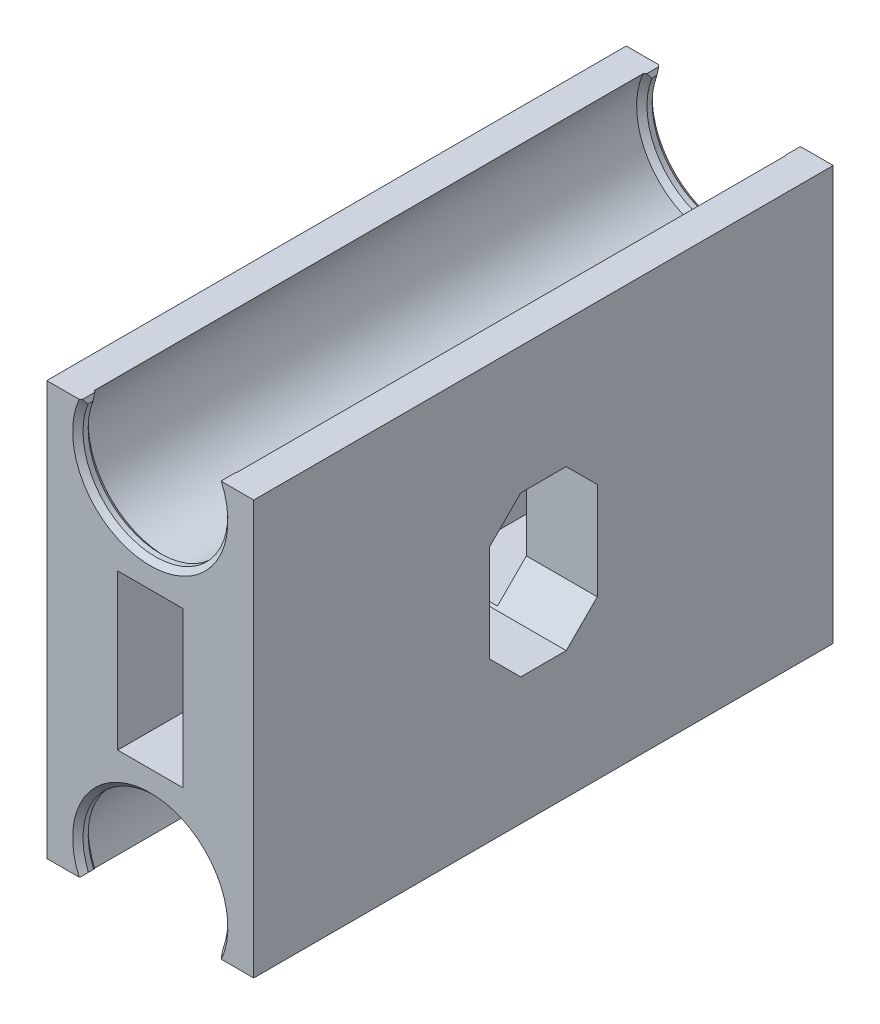
from build123d import *

# Parameters (mm, degrees)
SKETCH_1_W          = 6.3
SKETCH_1_H          = 15
EXTRUDE_1_DEPTH     = 56
CUT_EXTRUDE_START   = -1.5
SKETCH_2_R          = 7.5
CUT_EXTRUDE_1_DEPTH = 53
CHAMFER_1_SIZE      = 0.5
CHAMFER_1_SIZE_2    = 0.37535302
CUT_EXTRUDE_5_DEPTH = 57


with BuildPart() as part:
    # 草图1 → 凸台-拉伸1 (new body)
    with BuildSketch(Plane.XY):
        with BuildLine():
            Line((16.32455532, -40), (20, -40))
            Line((20, -40), (20, 0))
            Line((20, 0), (16.32455532, 0))
            ThreePointArc((16.32455532, 0), (10, -10), (3.67544468, 0))
            Line((3.67544468, 0), (0, 0))
            Line((0, 0), (0, -40))
            Line((0, -40), (3.67544468, -40))
            ThreePointArc((3.67544468, -40), (10, -30), (16.32455532, -40))
        make_face()
        with Locations((10, -20)):
            Rectangle(SKETCH_1_W, SKETCH_1_H, mode=Mode.SUBTRACT)
    extrude(amount=EXTRUDE_1_DEPTH)

    # 草图2 → 切除-拉伸1 (cut)
    with BuildSketch(Plane.XY.offset(56).offset(CUT_EXTRUDE_START)):
        with Locations((10, -3)):
            Circle(SKETCH_2_R)
        with Locations((10, -37)):
            Circle(SKETCH_2_R)
    extrude(amount=-CUT_EXTRUDE_1_DEPTH, mode=Mode.SUBTRACT)

    # 倒角1
    # the kernel refuses this chamfer: 0.5, 0.37535302 mm, written as the material it takes off along each edge
    with BuildSketch(Plane(origin=(10, -37, 56), x_dir=(-0.8097393602715859, -0.5867897139750857, 0), z_dir=(0.5867897139750857, -0.8097393602715859, 0))) as chamfer_1_piece_1:
        Polygon((7, CHAMFER_1_SIZE), (7 + CHAMFER_1_SIZE, 0), (7, 0), align=None)
    revolve(axis=Axis((10, -37, 56), (0, 0, -1)), revolution_arc=251.859051953, mode=Mode.SUBTRACT)
    with BuildSketch(Plane(origin=(10, -37, 54.5), x_dir=(-0.8097393602715859, -0.5867897139750857, 0), z_dir=(0.5867897139750857, -0.8097393602715859, 0))) as chamfer_1_piece_2:
        Polygon((7 + CHAMFER_1_SIZE, 0), (7, -CHAMFER_1_SIZE), (7, 0), align=None)
    revolve(axis=Axis((10, -37, 54.5), (0, 0, -1)), revolution_arc=251.859051953, mode=Mode.SUBTRACT)
    with BuildSketch(Plane(origin=(10, -37, 1.5), x_dir=(-0.8097393602715859, -0.5867897139750857, 0), z_dir=(0.5867897139750857, -0.8097393602715859, 0))) as chamfer_1_piece_3:
        Polygon((7, CHAMFER_1_SIZE), (7 + CHAMFER_1_SIZE, 0), (7, 0), align=None)
    revolve(axis=Axis((10, -37, 1.5), (0, 0, -1)), revolution_arc=251.859051953, mode=Mode.SUBTRACT)
    with BuildSketch(Plane(origin=(10, -37, 0), x_dir=(-0.8097393602715859, -0.5867897139750857, 0), z_dir=(0.5867897139750857, -0.8097393602715859, 0))) as chamfer_1_piece_4:
        Polygon((7, -CHAMFER_1_SIZE), (7 + CHAMFER_1_SIZE, 0), (7, 0), align=None)
    revolve(axis=Axis((10, -37, 0), (0, 0, -1)), revolution_arc=251.859051953, mode=Mode.SUBTRACT)
    with BuildSketch(Plane(origin=(10, -3, 1.5), x_dir=(0.809739360271586, 0.5867897139750856, 0), z_dir=(-0.5867897139750856, 0.809739360271586, 0))) as chamfer_1_piece_5:
        Polygon((7, CHAMFER_1_SIZE), (7 + CHAMFER_1_SIZE, 0), (7, 0), align=None)
    revolve(axis=Axis((10, -3, 1.5), (0, 0, -1)), revolution_arc=251.859051953, mode=Mode.SUBTRACT)
    with BuildSketch(Plane(origin=(10, -3, 0), x_dir=(0.809739360271586, 0.5867897139750856, 0), z_dir=(-0.5867897139750856, 0.809739360271586, 0))) as chamfer_1_piece_6:
        Polygon((7, -CHAMFER_1_SIZE), (7 + CHAMFER_1_SIZE, 0), (7, 0), align=None)
    revolve(axis=Axis((10, -3, 0), (0, 0, -1)), revolution_arc=251.859051953, mode=Mode.SUBTRACT)
    with BuildSketch(Plane(origin=(10, -3, 56), x_dir=(0.809739360271586, 0.5867897139750855, 0), z_dir=(-0.5867897139750855, 0.809739360271586, 0))) as chamfer_1_piece_7:
        Polygon((7, CHAMFER_1_SIZE), (7 + CHAMFER_1_SIZE, 0), (7, 0), align=None)
    revolve(axis=Axis((10, -3, 56), (0, 0, -1)), revolution_arc=251.859051953, mode=Mode.SUBTRACT)
    with BuildSketch(Plane(origin=(10, -3, 54.5), x_dir=(0.809739360271586, 0.5867897139750855, 0), z_dir=(-0.5867897139750855, 0.809739360271586, 0))) as chamfer_1_piece_8:
        Polygon((7 + CHAMFER_1_SIZE, 0), (7, -CHAMFER_1_SIZE), (7, 0), align=None)
    revolve(axis=Axis((10, -3, 54.5), (0, 0, -1)), revolution_arc=251.859051953, mode=Mode.SUBTRACT)
    with BuildSketch(Plane(origin=(16.32455532, 0, 53.214158506), x_dir=(1, 0, 0), z_dir=(0, 0, 1)), Plane(origin=(3.67544468, -40, 53.214158506), x_dir=(-1, 0, 0), z_dir=(0, 0, 1))) as chamfer_1_piece_9:
        with BuildLine():
            Line((CHAMFER_1_SIZE, 0), (0.153157056, -0.346842944))
            ThreePointArc((0.153157056, -0.346842944), (0.080388037, -0.175694672), (0, 0))
            Line((0, 0), (CHAMFER_1_SIZE, 0))
        make_face()
    extrude(amount=4.071682988, mode=Mode.SUBTRACT)
    with BuildSketch(Plane(origin=(16.32455532, 0, -1.285841494), x_dir=(0.4039450974717048, -0.9147832301854768, 0), z_dir=(0, 0, 1)), Plane(origin=(3.67544468, -40, -1.285841494), x_dir=(-0.4039450974717028, 0.9147832301854776, 0), z_dir=(0, 0, 1))) as chamfer_1_piece_10:
        with BuildLine():
            Line((0.37915315, 0), (CHAMFER_1_SIZE * 0.403945097472, CHAMFER_1_SIZE * 0.914783230185))
            Line((CHAMFER_1_SIZE * 0.403945097472, CHAMFER_1_SIZE * 0.914783230185), (0, 0))
            ThreePointArc((0, 0), (0.193194893, 0.002566627), (0.37915315, 0))
        make_face()
    extrude(amount=4.071682988, mode=Mode.SUBTRACT)
    with BuildSketch(Plane(origin=(3.67544468, 0, -1.336191622), x_dir=(-1, 0, 0), z_dir=(0, 0, 1)), Plane(origin=(3.67544468, 0, 53.163808378), x_dir=(-1, 0, 0), z_dir=(0, 0, 1)), Plane(origin=(16.32455532, -40, -1.336191622), x_dir=(1, 0, 0), z_dir=(0, 0, 1)), Plane(origin=(16.32455532, -40, 53.163808378), x_dir=(1, 0, 0), z_dir=(0, 0, 1))) as chamfer_1_piece_11:
        with BuildLine():
            Line((CHAMFER_1_SIZE_2, 0), (0.205125138, 0.477447103))
            ThreePointArc((0.205125138, 0.477447103), (0.109888705, 0.243565694), (0, 0))
            Line((0, 0), (CHAMFER_1_SIZE_2, 0))
        make_face()
    extrude(amount=4.172383245, mode=Mode.SUBTRACT)

    # 草图3 → 切除-拉伸5 (cut)
    with BuildSketch(Plane.ZY):
        Polygon((25.8, -12.3), (30.2, -12.3), (33.2, -15.3), (33.2, -24.7), (30.2, -27.7), (25.8, -27.7), (22.8, -24.7), (22.8, -15.3), align=None)
    extrude(amount=-CUT_EXTRUDE_5_DEPTH, mode=Mode.SUBTRACT)


solid = part.part
